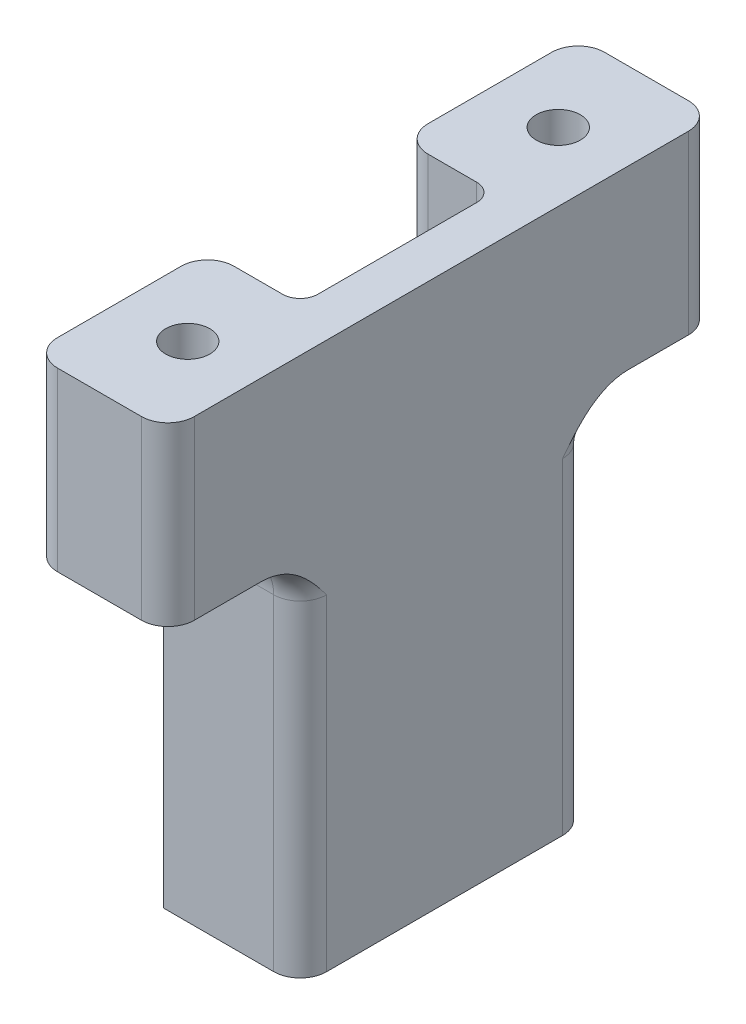
from build123d import *

# Parameters (mm, degrees)
SKETCH1_W             = 15.5
SKETCH1_H             = 62
BOSS_EXTRUDE1_DEPTH   = 62
FILLET1_R             = 3
CUT_EXTRUDE1_REACH    = 71.958
CUT_EXTRUDE2_DEPTH    = 42
FILLET2_R             = 5
M6_TAPPED_HOLE1_D     = 5
M6_TAPPED_HOLE1_DEPTH = 15
M6_TAPPED_HOLE1_TIP   = 1.502151548


with BuildPart() as part:
    # Sketch1 → Boss-Extrude1 (new body)
    with BuildSketch(Plane(origin=(0, 0, 0), x_dir=(1, 0, 0), z_dir=(0, 1, 0))):
        with Locations((-0.38, -0.37)):
            Rectangle(SKETCH1_W, SKETCH1_H)
    extrude(amount=-BOSS_EXTRUDE1_DEPTH)

    # Fillet1
    fillet1_edges = [part.edges().sort_by_distance(p)[0] for p in [
        (7.37, -31, 31.37),
        (-8.13, -31, 31.37),
        (-8.13, -31, -30.63),
        (7.37, -31, -30.63),
    ]]
    fillet(fillet1_edges, radius=FILLET1_R)

    # Sketch2 → Cut-Extrude1 (cut, up to next)
    with BuildSketch(Plane(origin=(0, 0, 0), x_dir=(1, 0, 0), z_dir=(0, 1, 0)), mode=Mode.PRIVATE) as cut_extrude1_sk1:
        with BuildLine():
            Line((-5.13, 10.63), (0.37, 10.63))
            ThreePointArc((0.37, 10.63), (1.784213562, 10.044213562), (2.37, 8.63))
            Line((2.37, 8.63), (2.37, -9.37))
            ThreePointArc((2.37, -9.37), (1.784213562, -10.784213562), (0.37, -11.37))
            Line((0.37, -11.37), (-5.13, -11.37))
            ThreePointArc((-5.13, -11.37), (-7.251320344, -12.248679656), (-8.13, -14.37))
            Line((-8.13, -14.37), (-8.13, 13.63))
            ThreePointArc((-8.13, 13.63), (-7.251320344, 11.508679656), (-5.13, 10.63))
        make_face()
    cut_extrude1_tool1 = extrude(cut_extrude1_sk1.sketch, amount=-CUT_EXTRUDE1_REACH, mode=Mode.PRIVATE) & part.part
    add(cut_extrude1_tool1.solids().sort_by_distance((-2.991251, 0, 0.37))[0], mode=Mode.SUBTRACT)

    # Sketch3 → Cut-Extrude2 (cut)
    with BuildSketch(Plane(origin=(0, -62, 0), x_dir=(1, 0, 0), z_dir=(0, 1, 0))):
        with BuildLine():
            Line((4.37, -16.37), (-8.13, -16.37))
            Line((-8.13, -16.37), (-8.13, -28.37))
            ThreePointArc((-8.13, -28.37), (-7.251320344, -30.491320344), (-5.13, -31.37))
            Line((-5.13, -31.37), (4.37, -31.37))
            ThreePointArc((4.37, -31.37), (6.491320344, -30.491320344), (7.37, -28.37))
            Line((7.37, -28.37), (7.37, -13.37))
            ThreePointArc((7.37, -13.37), (6.491320344, -15.491320344), (4.37, -16.37))
        make_face()
    cut_extrude2 = extrude(amount=CUT_EXTRUDE2_DEPTH, mode=Mode.SUBTRACT)

    # Mirror1: Cut-Extrude2 across plane
    add(cut_extrude2.mirror(Plane.XY), mode=Mode.SUBTRACT)

    # Fillet2
    # the kernel refuses this fillet: 5 mm, written as the material it adds along each edge
    with BuildSketch(Plane(origin=(4.37, -20, -16.37), x_dir=(0, -1, 0), z_dir=(-1, 0, 0)), Plane(origin=(4.37, -20, 16.37), x_dir=(0, 0, 1), z_dir=(-1, 0, 0))) as fillet2_piece_1:
        with BuildLine():
            CenterArc((FILLET2_R, -FILLET2_R), FILLET2_R, 90, 90)
            Line((0, -FILLET2_R), (0, 0))
            Line((0, 0), (FILLET2_R, 0))
        make_face()
    extrude(amount=12.5)
    with BuildSketch(Plane(origin=(4.37, -20, -13.37), x_dir=(-0.5176042277799098, 0, -0.855620163030514), z_dir=(0.855620163030514, 0, -0.5176042277799098))) as fillet2_piece_2_section:
        with BuildLine():
            CenterArc((-3 - FILLET2_R, -FILLET2_R), FILLET2_R, 0, 90)
            Line((-3, -FILLET2_R), (-3, 0))
            Line((-3, 0), (-3 - FILLET2_R, 0))
        make_face()
    fillet2_piece_2 = revolve(axis=Axis((4.37, -20, -13.37), (0, 1, 0)), revolution_arc=328.828315396, mode=Mode.PRIVATE)
    fillet2_piece_2 = split(fillet2_piece_2, bisect_by=Plane(origin=(6.644254363, -21.721658314, -10.63), z_dir=(0, 0, -1)), keep=Keep.TOP, mode=Mode.PRIVATE)
    fillet2_piece_2 = split(fillet2_piece_2, bisect_by=Plane(origin=(7.37, -21.721658314, -15.644254458), z_dir=(-1, 0, 0)), keep=Keep.TOP, mode=Mode.PRIVATE)
    add(fillet2_piece_2)
    with BuildSketch(Plane(origin=(4.37, -20, 13.37), x_dir=(-0.5176042277799098, 0, 0.855620163030514), z_dir=(0.855620163030514, 0, 0.5176042277799098))) as fillet2_piece_3_section:
        with BuildLine():
            CenterArc((-3 - FILLET2_R, FILLET2_R), FILLET2_R, 270, 90)
            Line((-3, FILLET2_R), (-3, 0))
            Line((-3, 0), (-3 - FILLET2_R, 0))
        make_face()
    fillet2_piece_3 = revolve(axis=Axis((4.37, -20, 13.37), (0, -1, 0)), revolution_arc=328.828315396, mode=Mode.PRIVATE)
    fillet2_piece_3 = split(fillet2_piece_3, bisect_by=Plane(origin=(6.644254403, -21.721658525, 11.37), z_dir=(0, 0, 1)), keep=Keep.TOP, mode=Mode.PRIVATE)
    fillet2_piece_3 = split(fillet2_piece_3, bisect_by=Plane(origin=(7.37, -21.721658525, 15.644254403), z_dir=(-1, 0, 0)), keep=Keep.TOP, mode=Mode.PRIVATE)
    add(fillet2_piece_3)

    # M6 Tapped Hole1
    with Locations(Plane(origin=(0, 0, 0), x_dir=(1, 0, 0), z_dir=(0, 1, 0))):
        with Locations((-0.38, 20.63), (-0.38, -21.37)):
            Hole(M6_TAPPED_HOLE1_D / 2, depth=M6_TAPPED_HOLE1_DEPTH)
            with Locations((0, 0, -(M6_TAPPED_HOLE1_DEPTH + M6_TAPPED_HOLE1_TIP / 2))):  # 118° drill point
                Cone(0, M6_TAPPED_HOLE1_D / 2, M6_TAPPED_HOLE1_TIP, mode=Mode.SUBTRACT)


solid = part.part
